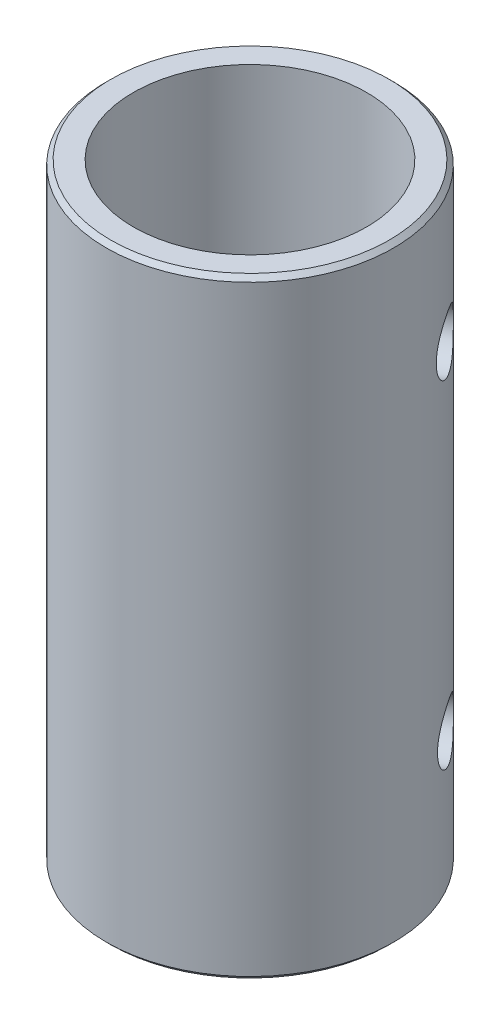
from build123d import *

# Parameters (mm, degrees)
SKETCH1_R               = 7.94
SKETCH1_R_2             = 6.44
BOSS_EXTRUDE1_DEPTH     = 33.7
CHAMFER1_SIZE           = 0.25
CUT_EXTRUDE1_DEPTH      = 38.740163132
CUT_EXTRUDE1_DEPTH_BACK = 38.740163132
SKETCH2_R               = 1.55
CUT_EXTRUDE2_DEPTH      = 38.745718031
CUT_EXTRUDE2_DEPTH_BACK = 38.745718031
SKETCH3_R               = 1.55


with BuildPart() as part:
    # Sketch1 → Boss-Extrude1 (new body)
    with BuildSketch(Plane(origin=(0, 0, 0), x_dir=(1, 0, 0), z_dir=(0, 1, 0))):
        Circle(SKETCH1_R)
        Circle(SKETCH1_R_2, mode=Mode.SUBTRACT)
    extrude(amount=BOSS_EXTRUDE1_DEPTH)

    # Chamfer1
    chamfer1_edges = [part.edges().sort_by_distance(p)[0] for p in [
        (-7.94, 0, 0),
        (-7.94, 33.7, 0),
    ]]
    chamfer(chamfer1_edges, length=CHAMFER1_SIZE)

    # Sketch2 → Cut-Extrude1 (cut, two sides: drawn at the far end of the back side and taken through both)
    with BuildSketch(Plane(origin=(-4.927525609, 0, 3.15309235), x_dir=(0.538990145384336, 0, 0.8423120699471024), z_dir=(-0.8423120699471024, 0, 0.538990145384336)).offset(-CUT_EXTRUDE1_DEPTH_BACK)):
        with Locations((0, 26.2)):
            Circle(SKETCH2_R)
    extrude(amount=CUT_EXTRUDE1_DEPTH + CUT_EXTRUDE1_DEPTH_BACK, mode=Mode.SUBTRACT)

    # Sketch3 → Cut-Extrude2 (cut, two sides: drawn at the far end of the back side and taken through both)
    with BuildSketch(Plane(origin=(-4.878312064, 0, 3.228710487), x_dir=(0.5519163225579942, 0, 0.8338994980775922), z_dir=(-0.8338994980775923, 0, 0.5519163225579942)).offset(-CUT_EXTRUDE2_DEPTH_BACK)):
        with Locations((0, 7.5)):
            Circle(SKETCH3_R)
    extrude(amount=CUT_EXTRUDE2_DEPTH + CUT_EXTRUDE2_DEPTH_BACK, mode=Mode.SUBTRACT)


solid = part.part
